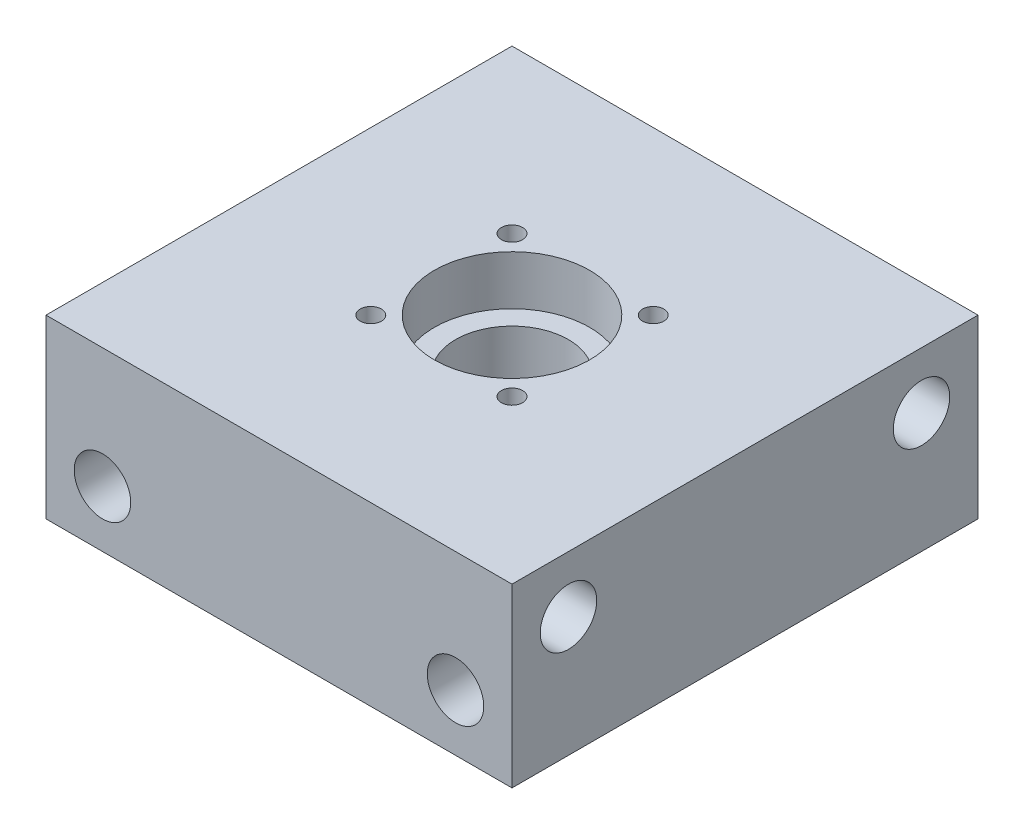
from build123d import *

# Parameters (mm, degrees)
SKETCH1_W           = 66
SKETCH1_H           = 66
SKETCH1_R           = 11
SKETCH1_R_2         = 1.5
BOSS_EXTRUDE1_DEPTH = 25
SKETCH1_4_R         = 11
SKETCH1_4_R_2       = 8
BOSS_EXTRUDE2_DEPTH = 18
SKETCH2_R           = 4
CUT_EXTRUDE1_DEPTH  = 78.910204723
SKETCH3_R           = 4
CUT_EXTRUDE2_DEPTH  = 78.910204723
SKETCH1_5_R         = 1.5
CUT_EXTRUDE3_DEPTH  = 16.833


with BuildPart() as part:
    # Sketch1 → Boss-Extrude1 (new body)
    with BuildSketch(Plane(origin=(0, 0, 0), x_dir=(1, 0, 0), z_dir=(0, 1, 0))):
        Rectangle(SKETCH1_W, SKETCH1_H)
        Circle(SKETCH1_R, mode=Mode.SUBTRACT)
        with Locations((10, 10)):
            Circle(SKETCH1_R_2, mode=Mode.SUBTRACT)
        with Locations((-10, -10)):
            Circle(SKETCH1_R_2, mode=Mode.SUBTRACT)
        with Locations((10, -10)):
            Circle(SKETCH1_R_2, mode=Mode.SUBTRACT)
        with Locations((-10, 10)):
            Circle(SKETCH1_R_2, mode=Mode.SUBTRACT)
    extrude(amount=BOSS_EXTRUDE1_DEPTH)

    # Sketch1<4> → Boss-Extrude2 (add)
    with BuildSketch(Plane(origin=(0, 0, 0), x_dir=(1, 0, 0), z_dir=(0, 1, 0))):
        Circle(SKETCH1_4_R)
        Circle(SKETCH1_4_R_2, mode=Mode.SUBTRACT)
    extrude(amount=BOSS_EXTRUDE2_DEPTH)

    # Sketch2 → Cut-Extrude1 (cut, through all)
    with BuildSketch(Plane.ZY.offset(33)):
        with Locations((-25, 17)):
            Circle(SKETCH2_R)
        with Locations((25, 17)):
            Circle(SKETCH2_R)
    extrude(amount=-CUT_EXTRUDE1_DEPTH, mode=Mode.SUBTRACT)

    # Sketch3 → Cut-Extrude2 (cut, through all)
    with BuildSketch(Plane(origin=(0, 0, -33), x_dir=(-1, 0, 0), z_dir=(0, 0, -1))):
        with Locations((-25, 8)):
            Circle(SKETCH3_R)
        with Locations((25, 8)):
            Circle(SKETCH3_R)
    extrude(amount=-CUT_EXTRUDE2_DEPTH, mode=Mode.SUBTRACT)

    # Sketch1<5> → Cut-Extrude3 (cut)
    # profile 1 of 4: a face of its own
    with BuildSketch(Plane(origin=(0, 0, 0), x_dir=(1, 0, 0), z_dir=(0, 1, 0))):
        Polygon((11.616580754, 7.2), (13.233161507, 10), (11.616580754, 12.8), (8.383419246, 12.8), (6.766838493, 10), (8.383419246, 7.2), align=None)
        with Locations((10, 10)):
            Circle(SKETCH1_5_R, mode=Mode.SUBTRACT)
    # profile 2 of 4: a face of its own
    with BuildSketch(Plane(origin=(0, 0, 0), x_dir=(1, 0, 0), z_dir=(0, 1, 0))):
        Polygon((-8.383419246, 7.2), (-6.766838493, 10), (-8.383419246, 12.8), (-11.616580754, 12.8), (-13.233161507, 10), (-11.616580754, 7.2), align=None)
        with Locations((-10, 10)):
            Circle(SKETCH1_5_R, mode=Mode.SUBTRACT)
    # profile 3 of 4: a face of its own
    with BuildSketch(Plane(origin=(0, 0, 0), x_dir=(1, 0, 0), z_dir=(0, 1, 0))):
        Polygon((11.616580754, -12.8), (13.233161507, -10), (11.616580754, -7.2), (8.383419246, -7.2), (6.766838493, -10), (8.383419246, -12.8), align=None)
        with Locations((10, -10)):
            Circle(SKETCH1_5_R, mode=Mode.SUBTRACT)
    # profile 4 of 4: a face of its own
    with BuildSketch(Plane(origin=(0, 0, 0), x_dir=(1, 0, 0), z_dir=(0, 1, 0))):
        Polygon((-8.383419246, -12.8), (-6.766838493, -10), (-8.383419246, -7.2), (-11.616580754, -7.2), (-13.233161507, -10), (-11.616580754, -12.8), align=None)
        with Locations((-10, -10)):
            Circle(SKETCH1_5_R, mode=Mode.SUBTRACT)
    extrude(amount=CUT_EXTRUDE3_DEPTH, mode=Mode.SUBTRACT)


solid = part.part
